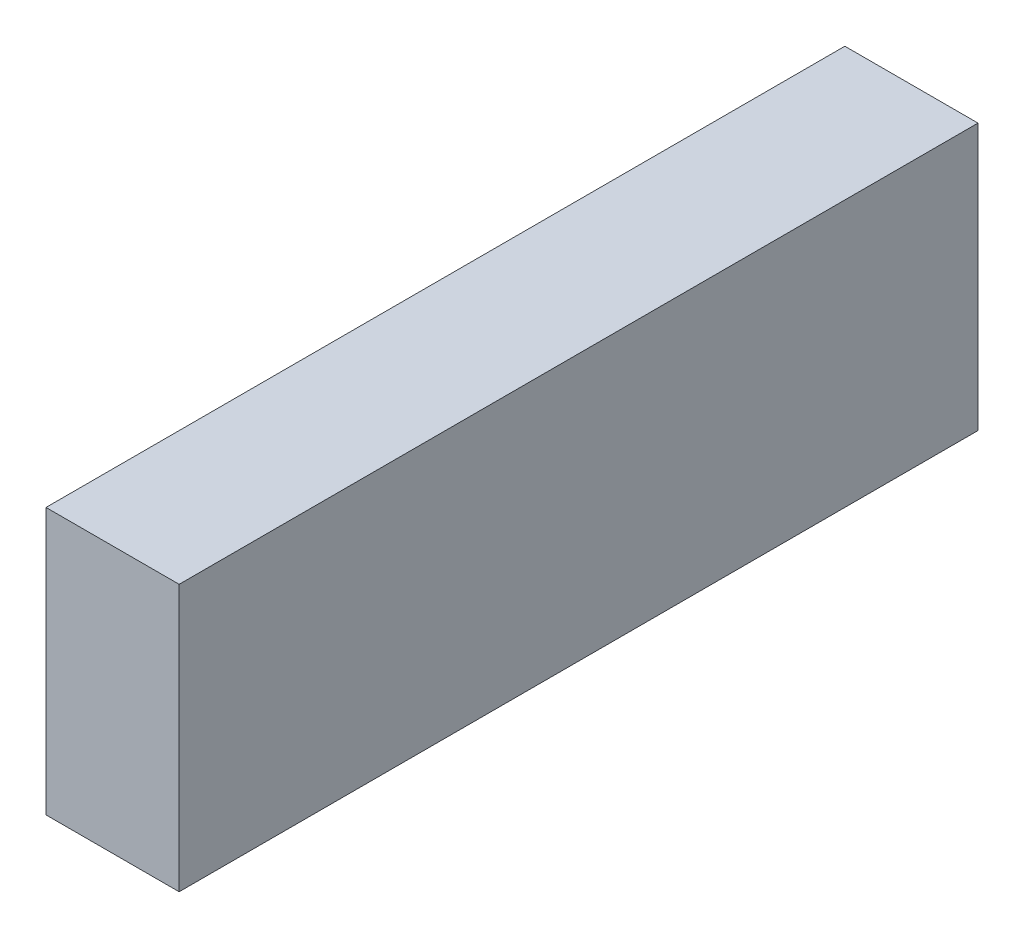
from build123d import *

# Parameters (mm, degrees)
SKETCH1_W           = 25.4
SKETCH1_H           = 50.8
BOSS_EXTRUDE1_DEPTH = 76.2


with BuildPart() as part:
    # Sketch1 → Boss-Extrude1 (new, symmetric)
    with BuildSketch(Plane.XY):
        Rectangle(SKETCH1_W, SKETCH1_H)
    extrude(amount=BOSS_EXTRUDE1_DEPTH, both=True)


solid = part.part
